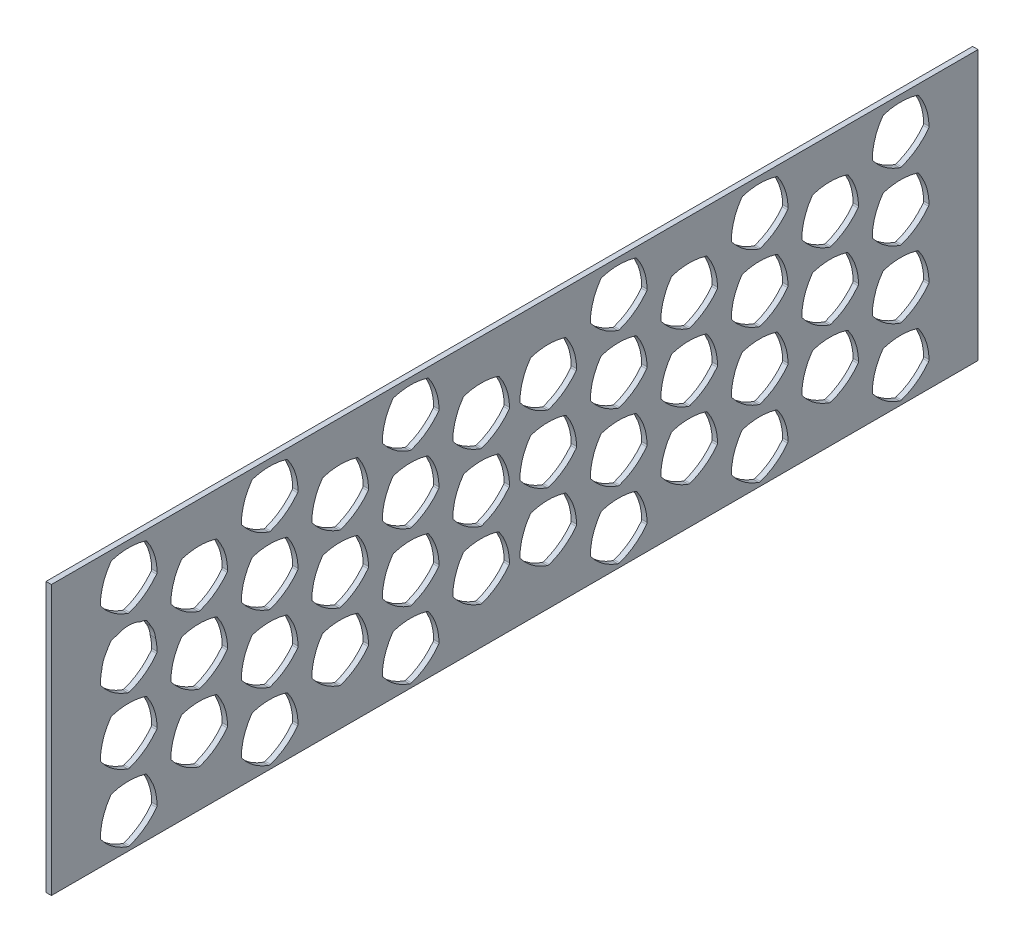
from build123d import *
from build123d.topology import SkipClean

# Parameters (mm, degrees)
SKETCH2_W           = 172
SKETCH2_H           = 50
BOSS_EXTRUDE2_DEPTH = 2
SKETCH26_R          = 10
CUT_EXTRUDE11_DEPTH = 2
CUT_EXTRUDE12_DEPTH = 2


with BuildPart() as part:
    # Sketch2 → Boss-Extrude2 (new body)
    with BuildSketch(Plane(origin=(0, 0, 0), x_dir=(0, 0, -1), z_dir=(1, 0, 0))):
        with Locations((-86, 25)):
            Rectangle(SKETCH2_W, SKETCH2_H)
    extrude(amount=-BOSS_EXTRUDE2_DEPTH)

    # Sketch26 → Cut-Extrude11 (cut)
    with BuildSketch(Plane(origin=(0, 0, 0), x_dir=(0, 0, -1), z_dir=(1, 0, 0))):
        with Locations((-143.288130824, 37.5)):
            Circle(SKETCH26_R)
        with Locations((-90.952674392, 37.5)):
            Circle(SKETCH26_R)
        with Locations((-117.120402608, 25)):
            Circle(SKETCH26_R)
        with Locations((-38.617217959, 37.5)):
            Circle(SKETCH26_R)
        with Locations((-90.952674392, 12.5)):
            Circle(SKETCH26_R)
        with Locations((-38.617217959, 12.5)):
            Circle(SKETCH26_R)
        with Locations((-143.288130824, 12.5)):
            Circle(SKETCH26_R)
        with Locations((-64.784946175, 25)):
            Circle(SKETCH26_R)
        with Locations((-12.449489743, 25)):
            Circle(SKETCH26_R)
        with Locations((-64.784946175, 0)):
            Circle(SKETCH26_R)
        with Locations((-12.449489743, 0)):
            Circle(SKETCH26_R)
        with Locations((-117.120402608, 0)):
            Circle(SKETCH26_R)
    extrude(amount=-CUT_EXTRUDE11_DEPTH, mode=Mode.SUBTRACT)

    # Mirror1: part across plane


with BuildPart() as part_1:
    add(part.part)
    add(part.part.mirror(Plane(origin=(-2, 0, 0), x_dir=(1, 0, 0), z_dir=(0, 0, -1))))

    # Mirror2: part across plane


with BuildPart() as part_2:
    with SkipClean():  # the faces are left unmerged after this step: merging them gives an invalid solid
        add(part_1.part)
        add(part_1.part.mirror(Plane(origin=(-2, 0, 172), x_dir=(0, 0, 1), z_dir=(0, -1, 0))))

    # Sketch32 → Cut-Extrude12 (cut)
    with SkipClean():  # the faces are left unmerged after this step: merging them gives an invalid solid
        with BuildSketch(Plane(origin=(0, 0, 0), x_dir=(0, 0, -1), z_dir=(1, 0, 0))):
            with BuildLine():
                ThreePointArc((-150.002557957, 46.1897098), (-152.798695987, 40.590169944), (-153.827899749, 34.416518342))
                ThreePointArc((-153.827899749, 34.416518342), (-153.779087817, 34.091281441), (-153.627408046, 33.799468327))
                ThreePointArc((-153.627408046, 33.799468327), (-149.165983347, 29.409830056), (-143.612533215, 26.523235849))
                ThreePointArc((-143.612533215, 26.523235849), (-143.288130824, 26.469155026), (-142.963728434, 26.523235849))
                ThreePointArc((-142.963728434, 26.523235849), (-137.410278301, 29.409830056), (-132.948853602, 33.799468327))
                ThreePointArc((-132.948853602, 33.799468327), (-132.797173831, 34.091281441), (-132.748361899, 34.416518342))
                ThreePointArc((-132.748361899, 34.416518342), (-133.777565661, 40.590169944), (-136.573703691, 46.1897098))
                ThreePointArc((-136.573703691, 46.1897098), (-136.804362828, 46.424141046), (-137.098597785, 46.571067682))
                ThreePointArc((-137.098597785, 46.571067682), (-143.288130824, 47.5), (-149.477663863, 46.571067682))
                ThreePointArc((-149.477663863, 46.571067682), (-149.77189882, 46.424141046), (-150.002557957, 46.1897098))
            make_face()
        cut_extrude12 = extrude(amount=-CUT_EXTRUDE12_DEPTH, mode=Mode.SUBTRACT)

    # Sketch-Pattern1: Cut-Extrude12 at 41 more places
    with SkipClean():  # the faces are left unmerged after this step: merging them gives an invalid solid
        with Locations((0, -25.52718, 0), (0, -12.5, -26.167728), (0, 0, -52.335456), (0, -37.5, -78.503185), (0, -25, -52.335456), (0, -12.5, -78.503185), (0, 0, -104.670913), (0, -25, -104.670913), (0, -12.5, -130.838641), (0, -37.5, -130.838641), (0, -62.5, -130.838641), (0, -50, -104.670913), (0, -75, -104.670913), (0, -62.5, -78.503185), (0, -75, -52.335456), (0, -50, -52.335456), (0, -37.5, -26.167728), (0, -62.5, -26.167728), (0, -37.5, -155.737621), (0, -12.5, -155.737621), (0, -62.5, -155.737621), (0, -75, -181.905349), (0, -50, -181.905349), (0, -25, -181.905349), (0, 0, -181.905349), (0, -12.5, -208.073077), (0, -37.5, -208.073077), (0, -62.5, -208.073077), (0, -75, -234.240805), (0, -50, -234.240805), (0, -25, -234.240805), (0, 0, -234.240805), (0, -12.5, -260.408533), (0, -37.5, -260.408533), (0, -62.5, -260.408533), (0, -75, -286.576262), (0, -50, -286.576262), (0, -25, -286.576262), (0, 0, -286.576262), (0, -50, 0), (0, -75, 0)):
            add(cut_extrude12, mode=Mode.SUBTRACT)


solid = part_2.part
